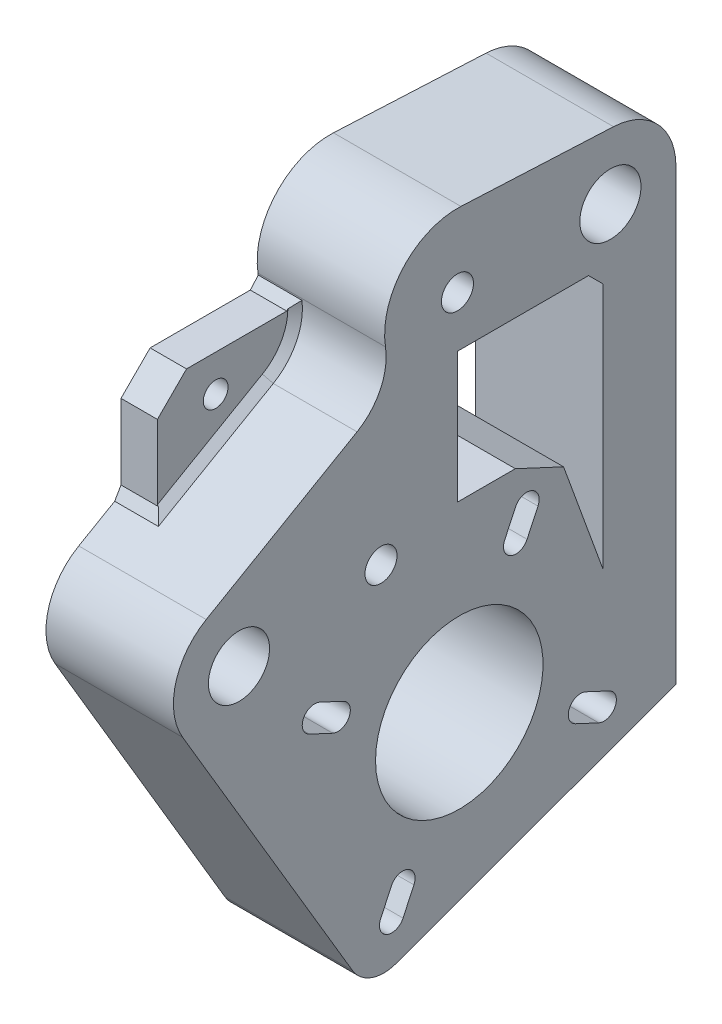
from build123d import *

# Parameters (mm, degrees)
BOSS_EXTRUDE1_DEPTH = 17.5
BOSS_EXTRUDE2_DEPTH = 5
CUT_EXTRUDE1_DEPTH  = 97.89865525603899
CUT_EXTRUDE2_DEPTH  = 97.89865525603899
CUT_EXTRUDE3_DEPTH  = 97.89865525603899
CUT_EXTRUDE4_DEPTH  = 97.89865525603899
CUT_EXTRUDE5_DEPTH  = 97.898655256039
HOLE1_D             = 3.4
HOLE2_D             = 8.4
HOLE3_D             = 4.4
HOLE4_D             = 23
HOLE5_D             = 8.4
HOLE6_D             = 4.4
FILLET1_R           = 8
CHAMFER1_SIZE       = 3.2892742843300167
CHAMFER1_SIZE2      = 5.503472902596259
CHAMFER2_SIZE       = 1.0000000000000073
CHAMFER3_SIZE       = 3.9999999999999973
CHAMFER4_SIZE       = 1.9999999999999982
CHAMFER5_SIZE       = 1.154784669
CHAMFER6_SIZE       = 0.9999999999999983
FILLET2_R           = 5
FILLET3_R           = 8.99999999999999
FILLET4_R           = 9.000000000000002


with BuildPart() as part:
    # Sketch1 → Boss-Extrude1 (new body)
    with BuildSketch(Plane(origin=(0, 0, 0), x_dir=(-6e-17, -1, 0), z_dir=(-1, 6e-17, 0))):
        with BuildLine():
            Line((11.200465877219063, 72.38053808131822), (-8.757531911002138, 37.812271894771776))
            ThreePointArc((-8.757531911002138, 37.812271894771776), (-19.5478712071735, 38.906001767514), (-24.988655696858714, 29.523809523809472))
            Line((-24.988655696858714, 29.523809523809472), (-23.581163303210467, 5.42e-15))
            Line((-23.581163303210467, 5.42e-15), (46.60534104687875, -6.94e-15))
            Line((46.60534104687875, -6.94e-15), (62.00126690227817, 42.299958639307405))
            Line((62.00126690227817, 42.299958639307405), (11.200465877219063, 72.38053808131822))
        make_face()
    extrude(amount=-BOSS_EXTRUDE1_DEPTH)

    # Sketch2 → Boss-Extrude2 (add)
    with BuildSketch(Plane(origin=(0, 0, 0), x_dir=(-6e-17, -1, 0), z_dir=(-1, 6e-17, 0))):
        with BuildLine():
            Line((-8.757531911002138, 37.812271894771776), (3.3020035333110394, 58.69999999999994))
            Line((3.3020035333110394, 58.69999999999994), (-12.000000000000004, 58.699999999999946))
            Line((-12.000000000000004, 58.699999999999946), (-12.000000000000004, 39.539392014169366))
            ThreePointArc((-12.000000000000004, 39.539392014169366), (-10.298772493194686, 38.826010419734104), (-8.757531911002138, 37.812271894771776))
        make_face()
    extrude(amount=-BOSS_EXTRUDE2_DEPTH)

    # Sketch3 → Cut-Extrude1 (cut, through all)
    with BuildSketch(Plane.ZY):
        with BuildLine():
            Line((18.94418997404675, -15.937202057164905), (20.43837116769735, -19.141483967443826))
            ThreePointArc((20.43837116769735, -19.141483967443826), (22.697545450618843, -19.96375616044696), (23.519817643621966, -17.70458187752546))
            Line((23.519817643621966, -17.70458187752546), (22.02563644997135, -14.500299967246516))
            ThreePointArc((22.02563644997135, -14.500299967246516), (19.766462167049855, -13.67802777424341), (18.94418997404675, -15.937202057164905))
        make_face()
    extrude(amount=-CUT_EXTRUDE1_DEPTH, mode=Mode.SUBTRACT)

    # Sketch4 → Cut-Extrude2 (cut, through all)
    with BuildSketch(Plane.ZY):
        with BuildLine():
            Line((48.89693341141304, -24.280652217339153), (45.692651501134065, -25.774833410989757))
            ThreePointArc((45.692651501134065, -25.774833410989757), (44.87037930813095, -28.034007693911235), (47.12955359105242, -28.85627988691438))
            Line((47.12955359105242, -28.85627988691438), (50.33383550133139, -27.362098693263775))
            ThreePointArc((50.33383550133139, -27.362098693263775), (51.156107694334516, -25.102924410342293), (48.89693341141304, -24.280652217339153))
        make_face()
    extrude(amount=-CUT_EXTRUDE2_DEPTH, mode=Mode.SUBTRACT)

    # Sketch5 → Cut-Extrude3 (cut, through all)
    with BuildSketch(Plane.ZY):
        with BuildLine():
            Line((35.97785558166356, -52.46601583434486), (37.47203677531419, -55.6702977446238))
            ThreePointArc((37.47203677531419, -55.6702977446238), (39.73121105823568, -56.4925699376269), (40.55348325123879, -54.233395654705404))
            Line((40.55348325123879, -54.233395654705404), (39.059302057588205, -51.02911374442645))
            ThreePointArc((39.059302057588205, -51.02911374442645), (36.80012777466672, -50.20684155142337), (35.97785558166356, -52.46601583434486))
        make_face()
    extrude(amount=-CUT_EXTRUDE3_DEPTH, mode=Mode.SUBTRACT)

    # Sketch6 → Cut-Extrude4 (cut, through all)
    with BuildSketch(Plane.ZY):
        with BuildLine():
            Line((10.600739813872503, -45.8899454945312), (13.805021724151473, -44.395764300880586))
            ThreePointArc((13.805021724151473, -44.395764300880586), (14.627293917154569, -42.136590017959094), (12.36811963423308, -41.314317824955985))
            Line((12.36811963423308, -41.314317824955985), (9.163837723954103, -42.8084990186066))
            ThreePointArc((9.163837723954103, -42.8084990186066), (8.341565530951023, -45.06767330152808), (10.600739813872503, -45.8899454945312))
        make_face()
    extrude(amount=-CUT_EXTRUDE4_DEPTH, mode=Mode.SUBTRACT)

    # Sketch7 → Cut-Extrude5 (cut, through all)
    with BuildSketch(Plane(origin=(17.5, -1.07e-15, 0), x_dir=(0, 0, -1), z_dir=(1, -6e-17, 0))):
        Polygon((-30.000000000000007, 8.000000000000005), (-30.000000000000007, -9.938112905604582), (-16.55393055212617, -9.938112905604578), (-10.000000000000002, -27.94488910624502), (-10.000000000000002, 8.000000000000005), align=None)
    extrude(amount=-CUT_EXTRUDE5_DEPTH, mode=Mode.SUBTRACT)

    # Hole1 (through all)
    with Locations(Plane(origin=(5, -3.1e-16, 0), x_dir=(0, 0, -1), z_dir=(1, -6e-17, 0))):
        with Locations((-50.7, 7)):
            Hole(HOLE1_D / 2)

    # Hole2 (through all)
    with Locations(Plane.ZY):
        with Locations((9, 15)):
            Hole(HOLE2_D / 2)

    # Hole3 (through all)
    with Locations(Plane.ZY):
        with Locations((40.5, -12.150669091)):
            Hole(HOLE3_D / 2)

    # Hole4 (through all)
    with Locations(Plane.ZY):
        with Locations((29.748836613, -35.085298856)):
            Hole(HOLE4_D / 2)

    # Hole5 (through all)
    with Locations(Plane.ZY):
        with Locations((60, -14.444863729)):
            Hole(HOLE5_D / 2)

    # Hole6 (through all)
    with Locations(Plane.ZY):
        with Locations((30, 15)):
            Hole(HOLE6_D / 2)

    # Fillet1
    fillet1_edges = [part.edges().sort_by_distance(p)[0] for p in [
        (11.25, 8.757531911002138, 37.812271894771776),
    ]]
    fillet(fillet1_edges, radius=FILLET1_R)

    # Chamfer1
    chamfer1_edges = [part.edges().sort_by_distance(p)[0] for p in [
        (8.75, -9.93811290560458, 16.55393055212617),
    ]]
    chamfer1_side = [part.faces().sort_by_distance(p)[0] for p in [
        (8.750000000000002, -18.941501005924803, 13.276965276063088),
    ]]
    chamfer(chamfer1_edges, length=CHAMFER1_SIZE, length2=CHAMFER1_SIZE2, reference=chamfer1_side[0])

    # Chamfer2
    chamfer2_edges = [part.edges().sort_by_distance(p)[0] for p in [
        (2.5, -3.3020035333110394, 58.69999999999994),
    ]]
    chamfer(chamfer2_edges, length=CHAMFER2_SIZE)

    # Chamfer3
    chamfer3_edges = [part.edges().sort_by_distance(p)[0] for p in [
        (2.500000000000001, 12.000000000000004, 58.699999999999946),
    ]]
    chamfer(chamfer3_edges, length=CHAMFER3_SIZE)

    # Chamfer4
    chamfer4_edges = [part.edges().sort_by_distance(p)[0] for p in [
        (8.75, 8.000000000000004, 10.000000000000002),
    ]]
    chamfer(chamfer4_edges, length=CHAMFER4_SIZE)

    # Chamfer5
    # the kernel refuses this chamfer: 1.339656624, 1.154784669 mm, written as the material it adds along each edge
    with BuildSketch(Plane(origin=(5.000000000000001, 12.000000000000004, 39.790087105703904), x_dir=(0, 0, 1), z_dir=(-1, 6e-17, 0))) as chamfer5_piece_1:
        with BuildLine():
            Line((CHAMFER5_SIZE, 0), (0.05834718904861802, 1.2292620817061763))
            ThreePointArc((0.05834718904861802, 1.2292620817061763), (0.00643151248669227, 0.6348707855031801), (0, 0))
            Line((0, 0), (CHAMFER5_SIZE, 0))
        make_face()
    extrude(amount=5)

    # Chamfer6
    chamfer6_edges = [part.edges().sort_by_distance(p)[0] for p in [
        (5.000000000000001, 0.7531265976075634, 51.67630858194548),
        (5, 8.674926913627807, 40.6231092014468),
    ]]
    chamfer(chamfer6_edges, length=CHAMFER6_SIZE)

    # Fillet2
    fillet2_edges = [part.edges().sort_by_distance(p)[0] for p in [
        (8.749999999999996, -62.00126690227817, 42.299958639307405),
    ]]
    fillet(fillet2_edges, radius=FILLET2_R)

    # Fillet3
    fillet3_edges = [part.edges().sort_by_distance(p)[0] for p in [
        (8.75, -11.200465877219063, 72.38053808131822),
    ]]
    fillet(fillet3_edges, radius=FILLET3_R)

    # Fillet4
    fillet4_edges = [part.edges().sort_by_distance(p)[0] for p in [
        (8.750000000000002, 23.581163303210467, 5.42e-15),
    ]]
    fillet(fillet4_edges, radius=FILLET4_R)


solid = part.part
